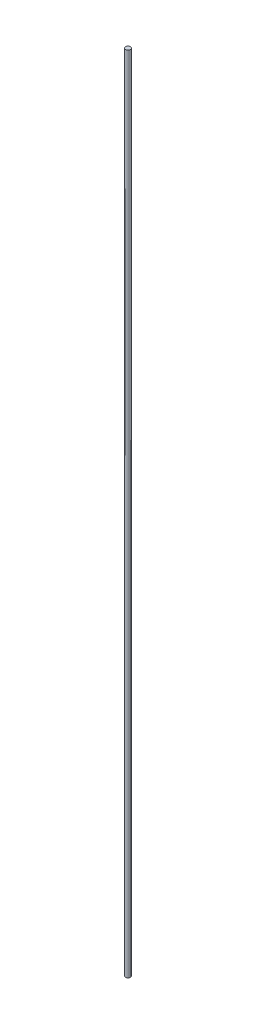
from build123d import *

# Parameters (mm, degrees)
SKETCH_2_W = 2.5
SKETCH_2_H = 806.6


with BuildPart() as part:
    # Эскиз2 → Повернуть1 (revolve)
    with BuildSketch(Plane.XY):
        with Locations((-1.25, -77.151481828)):
            Rectangle(SKETCH_2_W, SKETCH_2_H)
    revolve(axis=Axis((-2.5, 326.148518172, 0), (0, -1, 0)))


solid = part.part
